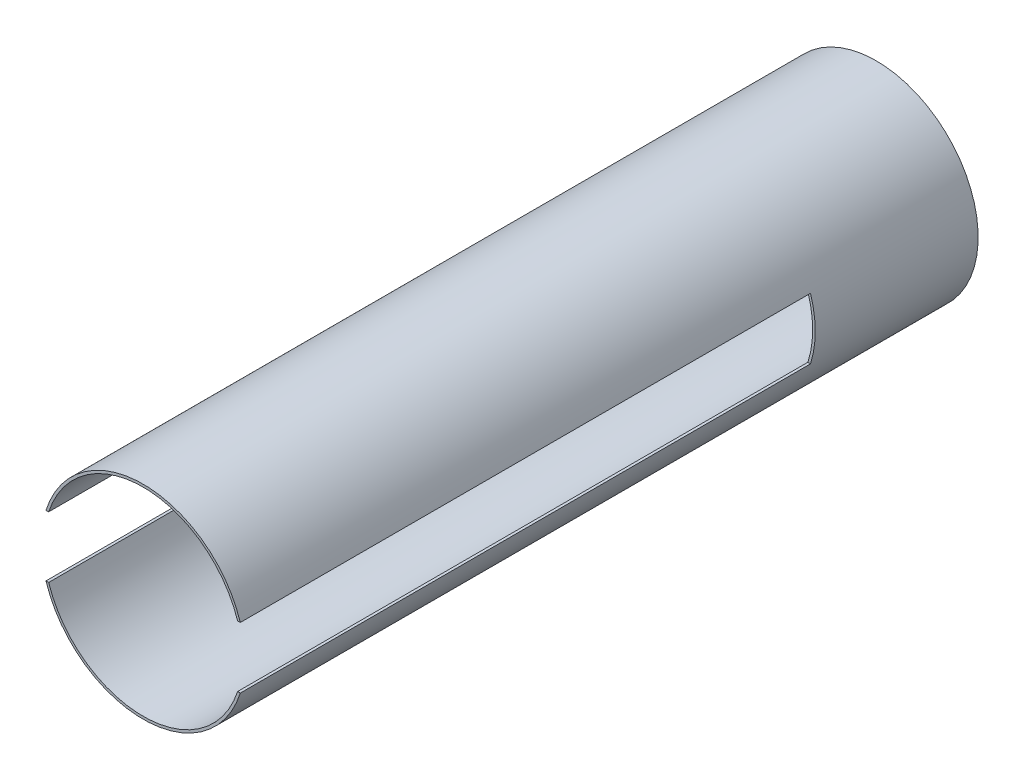
from build123d import *
from build123d.topology import SkipClean

# Parameters (mm, degrees)
BOSS_EXTRUDE1_DEPTH   = 177.8
BOSS_EXTRUDE1_2_DEPTH = 177.8
SKETCH2_R             = 63.5
SKETCH2_R_2           = 61.9125
BOSS_EXTRUDE2_DEPTH   = 101.6


with BuildPart() as part:
    # Sketch1 → Boss-Extrude1 (new, symmetric)
    with BuildSketch(Plane.XY):
        with BuildLine():
            Line((-58.908871626, -19.05), (-60.57513929, -19.05))
            ThreePointArc((-60.57513929, -19.05), (0, -63.5), (60.57513929, -19.05))
            Line((60.57513929, -19.05), (58.908871626, -19.05))
            ThreePointArc((58.908871626, -19.05), (0, -61.9125), (-58.908871626, -19.05))
        make_face()
    extrude(amount=BOSS_EXTRUDE1_DEPTH, both=True)



with BuildPart() as body_2:
    # Sketch1 → Boss-Extrude1 2 (new, symmetric)
    with BuildSketch(Plane.XY):
        with BuildLine():
            ThreePointArc((60.57513929, 19.05), (0, 63.5), (-60.57513929, 19.05))
            Line((-60.57513929, 19.05), (-58.908871626, 19.05))
            ThreePointArc((-58.908871626, 19.05), (0, 61.9125), (58.908871626, 19.05))
            Line((58.908871626, 19.05), (60.57513929, 19.05))
        make_face()
    extrude(amount=BOSS_EXTRUDE1_2_DEPTH, both=True)


with BuildPart() as part_1:
    with SkipClean():  # the faces are left unmerged after this step: merging them gives an invalid solid
        add(part.part)

        add(body_2.part)  # Boss-Extrude2 merges body 2
        # Sketch2 → Boss-Extrude2 (add)
        with BuildSketch(Plane(origin=(0, 0, -177.8), x_dir=(-1, 0, 0), z_dir=(0, 0, -1))):
            Circle(SKETCH2_R)
            Circle(SKETCH2_R_2, mode=Mode.SUBTRACT)
        extrude(amount=BOSS_EXTRUDE2_DEPTH)


solid = part_1.part
